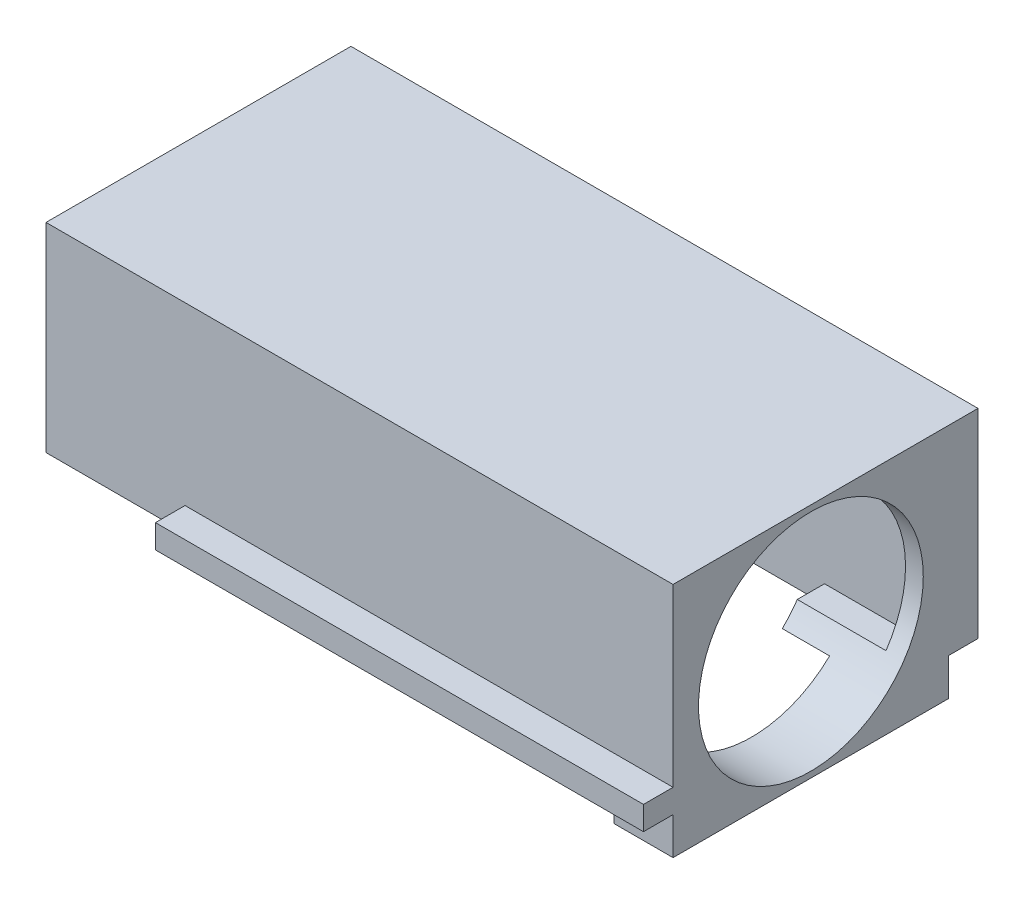
from build123d import *

# Parameters (mm, degrees)
BOSS_EXTRUDE1_DEPTH = 46.6
CUT_EXTRUDE1_REACH  = 124.505
SKETCH2_R           = 19
SKETCH3_W           = 3
SKETCH3_H           = 30.7
BOSS_EXTRUDE2_DEPTH = 103
SKETCH4_W           = 5
SKETCH4_H           = 4
BOSS_EXTRUDE3_DEPTH = 82.5
SKETCH6_W           = 3
SKETCH6_H           = 33.7
BOSS_EXTRUDE4_DEPTH = 106
SKETCH8_W           = 4.95
SKETCH8_H           = 33.7
BOSS_EXTRUDE5_DEPTH = 106


with BuildPart() as part:
    # Sketch1 → Boss-Extrude1 (new body)
    with BuildSketch(Plane.XY):
        Polygon((0, 0), (0, 40), (-106, 40), (-106, 37), (-3, 37), (-3, 9.3), (-18, 9.3), (-18, 6.3), (-10, 6.3), (-10, 0), align=None)
    extrude(amount=BOSS_EXTRUDE1_DEPTH)

    # Sketch2 → Cut-Extrude1 (cut, up to next)
    with BuildSketch(Plane(origin=(0, 0, 0), x_dir=(0, 0, -1), z_dir=(1, 0, 0)), mode=Mode.PRIVATE) as cut_extrude1_sk1:
        with Locations((-23.3, 20)):
            Circle(SKETCH2_R)
    cut_extrude1_tool1 = extrude(cut_extrude1_sk1.sketch, amount=-CUT_EXTRUDE1_REACH, mode=Mode.PRIVATE) & part.part
    add(cut_extrude1_tool1.solids().sort_by_distance((0, 20, 23.3))[0], mode=Mode.SUBTRACT)

    # Sketch3 → Boss-Extrude2 (add)
    with BuildSketch(Plane.ZY.offset(3)):
        with Locations((45.1, 21.65)):
            Rectangle(SKETCH3_W, SKETCH3_H)
    extrude(amount=BOSS_EXTRUDE2_DEPTH)

    # Sketch4 → Boss-Extrude3 (add)
    with BuildSketch(Plane(origin=(0, 0, 0), x_dir=(0, 0, -1), z_dir=(1, 0, 0))):
        with Locations((-49.1, 8.3)):
            Rectangle(SKETCH4_W, SKETCH4_H)
    extrude(amount=-BOSS_EXTRUDE3_DEPTH)

    # Sketch6 → Boss-Extrude4 (add)
    with BuildSketch(Plane(origin=(0, 0, 0), x_dir=(0, 0, -1), z_dir=(1, 0, 0))):
        with Locations((-1.5, 23.15)):
            Rectangle(SKETCH6_W, SKETCH6_H)
    extrude(amount=-BOSS_EXTRUDE4_DEPTH)

    # Sketch8 → Boss-Extrude5 (add)
    with BuildSketch(Plane(origin=(0, 0, 0), x_dir=(0, 0, -1), z_dir=(1, 0, 0))):
        with Locations((2.475, 23.15)):
            Rectangle(SKETCH8_W, SKETCH8_H)
    extrude(amount=-BOSS_EXTRUDE5_DEPTH)


solid = part.part
